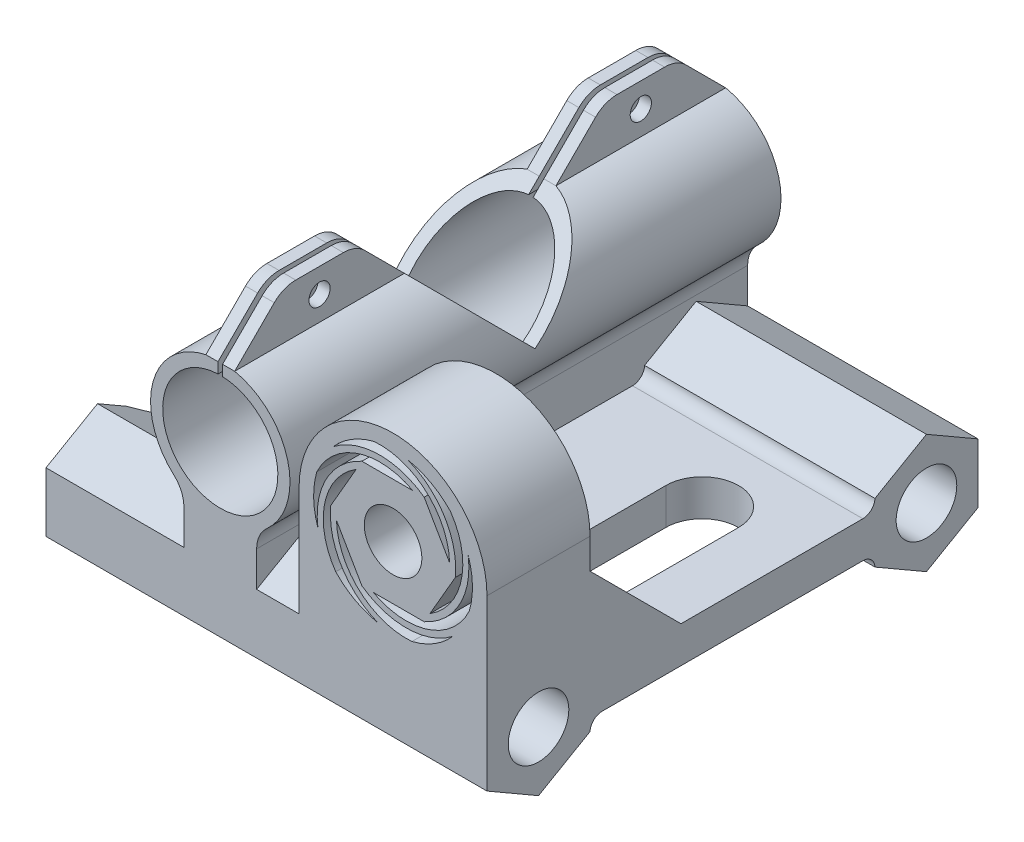
from build123d import *

# Parameters (mm, degrees)
BOSS_EXTRUDE1_DEPTH     = 72.75
CUT_EXTRUDE1_DEPTH      = 30
CUT_EXTRUDE1_DEPTH_BACK = 28
FILLET3_R               = 2
BOSS_EXTRUDE2_REACH     = 111.316
FILLET4_R               = 5
SKETCH5_R               = 4.75
BOSS_EXTRUDE7_DEPTH     = 17
CUT_EXTRUDE2_DEPTH      = 7.5
CUT_EXTRUDE3_REACH      = 109.48
SKETCH7_R               = 1.75
CHAMFER1_SIZE           = 8
FILLET5_R               = 5
SKETCH9_R               = 5
CUT_EXTRUDE5_DEPTH      = 50
CUT_EXTRUDE8_DEPTH      = 10
BOSS_EXTRUDE10_DEPTH    = 3.5
BOSS_EXTRUDE11_DEPTH    = 3.5
CUT_EXTRUDE9_DEPTH      = 17


# Some blends are built 0.0001 mm under size
with BuildPart() as part:
    # Sketch2 → Boss-Extrude1 (new body)
    with BuildSketch(Plane(origin=(0, 0, 0), x_dir=(0, 0, -1), z_dir=(1, 0, 0))):
        Polygon((2.888738281, 3), (49.888738281, 3), (49.888738281, 4.907477288), (58.388738281, 9.814954576), (66.888738281, 4.907477288), (66.888738281, -4.907477288), (58.388738281, -9.814954576), (49.888738281, -4.907477288), (49.888738281, -3), (2.888738281, -3), (2.888738281, -4.907477288), (-5.611261719, -9.814954576), (-14.111261719, -4.907477288), (-14.111261719, 4.907477288), (-5.611261719, 9.814954576), (2.888738281, 4.907477288), align=None)
    extrude(amount=BOSS_EXTRUDE1_DEPTH)

    # Sketch3 → Cut-Extrude1 (cut, two sides: drawn at the far end of the back side and taken through both)
    with BuildSketch(Plane(origin=(0, 3, 0), x_dir=(1, 0, 0), z_dir=(0, 1, 0)).offset(-CUT_EXTRUDE1_DEPTH_BACK)):
        Polygon((1.75, 48.138738281), (1.75, 2.888738281), (0, -0.861261719), (0, 51.638738281), (1.75, 49.888738281), align=None)
    extrude(amount=CUT_EXTRUDE1_DEPTH + CUT_EXTRUDE1_DEPTH_BACK, mode=Mode.SUBTRACT)

    # Fillet3
    # the kernel refuses this fillet: 2 mm, written as the material it adds along each edge
    with BuildSketch(Plane(origin=(1.75, -3, -2.888738281), x_dir=(0, 0, -1), z_dir=(1, 0, 0))) as fillet3_piece_1_section:
        with BuildLine():
            CenterArc((1.997858741, -2), FILLET3_R, 90, 87.348473215)
            Line((0, -1.907477288), (-0.039957175, -1.905626834))
            ThreePointArc((-0.039957175, -1.905626834), (-0.04, -0.953738644), (-0.04, 0))
            Line((-0.04, 0), (0, 0.04))
            Line((0, 0.04), (1.997858741, 0.04))
            Line((1.997858741, 0.04), (1.997858741, 0))
        make_face()
    fillet3_piece_1 = extrude(amount=71, mode=Mode.PRIVATE)
    fillet3_piece_1 = split(fillet3_piece_1, bisect_by=Plane(origin=(1.75, -3, -2.888738281), z_dir=(-0.9061831399952585, 0, -0.42288546533113874)), keep=Keep.TOP, mode=Mode.PRIVATE)
    add(fillet3_piece_1)
    with BuildSketch(Plane(origin=(-3.244646852, -3, -2.888738281), x_dir=(0, 0, -1), z_dir=(1, 0, 0))) as fillet3_piece_2_section:
        with BuildLine():
            CenterArc((1.997858741, -2), FILLET3_R, 90, 87.348473215)
            Line((0, -1.907477288), (-0.039957175, -1.905626834))
            ThreePointArc((-0.039957175, -1.905626834), (-0.04, -0.953738644), (-0.04, 0))
            Line((-0.04, 0), (0, 0.04))
            Line((0, 0.04), (1.997858741, 0.04))
            Line((1.997858741, 0.04), (1.997858741, 0))
        make_face()
    fillet3_piece_2 = extrude(amount=75.994646852, mode=Mode.PRIVATE)
    fillet3_piece_2 = split(fillet3_piece_2, bisect_by=Plane(origin=(1.75, -3, -2.888738281), z_dir=(-1, 0, 0)), keep=Keep.TOP, mode=Mode.PRIVATE)
    fillet3_piece_2 = split(fillet3_piece_2, bisect_by=Plane(origin=(0.856796731, -3, -0.974731276), z_dir=(0.9061831399952585, 0, 0.42288546533113874)), keep=Keep.TOP, mode=Mode.PRIVATE)
    add(fillet3_piece_2)
    with BuildSketch(Plane(origin=(1.75, -3, -2.888738281), x_dir=(0, 0, -1), z_dir=(1, 0, 0))) as fillet3_piece_3_section:
        with BuildLine():
            CenterArc((1.997858741, -2), FILLET3_R, 90, 87.348473215)
            Line((0, -1.907477288), (-0.039957175, -1.905626834))
            ThreePointArc((-0.039957175, -1.905626834), (-0.04, -0.953738644), (-0.04, 0))
            Line((-0.04, 0), (0, 0.04))
            Line((0, 0.04), (1.997858741, 0.04))
            Line((1.997858741, 0.04), (1.997858741, 0))
        make_face()
    fillet3_piece_3 = extrude(amount=71, mode=Mode.PRIVATE)
    fillet3_piece_3 = split(fillet3_piece_3, bisect_by=Plane(origin=(1.75, -3, -2.888738281), z_dir=(0.9061831399952585, 0, 0.42288546533113874)), keep=Keep.TOP, mode=Mode.PRIVATE)
    add(fillet3_piece_3)
    with BuildSketch(Plane(origin=(1.75, -3, -49.888738281), x_dir=(0, 0, 1), z_dir=(1, 0, 0))) as fillet3_piece_4_section:
        with BuildLine():
            CenterArc((1.997858741, 2), FILLET3_R, 182.651526785, 87.348473215)
            Line((0, 1.907477288), (-0.039957175, 1.905626834))
            ThreePointArc((-0.039957175, 1.905626834), (-0.04, 0.953738644), (-0.04, 0))
            Line((-0.04, 0), (0, -0.04))
            Line((0, -0.04), (1.997858741, -0.04))
            Line((1.997858741, -0.04), (1.997858741, 0))
        make_face()
    fillet3_piece_4 = extrude(amount=71, mode=Mode.PRIVATE)
    fillet3_piece_4 = split(fillet3_piece_4, bisect_by=Plane(origin=(1.75, -3, -49.888738281), z_dir=(-0.707106781186547, 0, 0.7071067811865481)), keep=Keep.TOP, mode=Mode.PRIVATE)
    add(fillet3_piece_4)
    with BuildSketch(Plane(origin=(-3.244646852, -3, -49.888738281), x_dir=(0, 0, 1), z_dir=(1, 0, 0))) as fillet3_piece_5_section:
        with BuildLine():
            CenterArc((1.997858741, 2), FILLET3_R, 182.651526785, 87.348473215)
            Line((0, 1.907477288), (-0.039957175, 1.905626834))
            ThreePointArc((-0.039957175, 1.905626834), (-0.04, 0.953738644), (-0.04, 0))
            Line((-0.04, 0), (0, -0.04))
            Line((0, -0.04), (1.997858741, -0.04))
            Line((1.997858741, -0.04), (1.997858741, 0))
        make_face()
    fillet3_piece_5 = extrude(amount=75.994646852, mode=Mode.PRIVATE)
    fillet3_piece_5 = split(fillet3_piece_5, bisect_by=Plane(origin=(1.75, -3, -49.888738281), z_dir=(-1, 0, 0)), keep=Keep.TOP, mode=Mode.PRIVATE)
    fillet3_piece_5 = split(fillet3_piece_5, bisect_by=Plane(origin=(-0.747323426, -3, -52.386061707), z_dir=(0.707106781186547, 0, -0.7071067811865481)), keep=Keep.TOP, mode=Mode.PRIVATE)
    add(fillet3_piece_5)
    with BuildSketch(Plane(origin=(1.75, -3, -49.888738281), x_dir=(0, 0, 1), z_dir=(1, 0, 0))) as fillet3_piece_6_section:
        with BuildLine():
            CenterArc((1.997858741, 2), FILLET3_R, 182.651526785, 87.348473215)
            Line((0, 1.907477288), (-0.039957175, 1.905626834))
            ThreePointArc((-0.039957175, 1.905626834), (-0.04, 0.953738644), (-0.04, 0))
            Line((-0.04, 0), (0, -0.04))
            Line((0, -0.04), (1.997858741, -0.04))
            Line((1.997858741, -0.04), (1.997858741, 0))
        make_face()
    fillet3_piece_6 = extrude(amount=71, mode=Mode.PRIVATE)
    fillet3_piece_6 = split(fillet3_piece_6, bisect_by=Plane(origin=(1.75, -3, -49.888738281), z_dir=(0.707106781186547, 0, -0.7071067811865481)), keep=Keep.TOP, mode=Mode.PRIVATE)
    add(fillet3_piece_6)
    with BuildSketch(Plane(origin=(1.75, 3, -49.888738281), x_dir=(0, 0, 1), z_dir=(1, 0, 0))) as fillet3_piece_7_section:
        with BuildLine():
            CenterArc((1.997858741, -2), FILLET3_R, 90, 87.348473215)
            Line((0, -1.907477288), (-0.039957175, -1.905626834))
            ThreePointArc((-0.039957175, -1.905626834), (-0.04, -0.953738644), (-0.04, 0))
            Line((-0.04, 0), (0, 0.04))
            Line((0, 0.04), (1.997858741, 0.04))
            Line((1.997858741, 0.04), (1.997858741, 0))
        make_face()
    fillet3_piece_7 = extrude(amount=71, mode=Mode.PRIVATE)
    fillet3_piece_7 = split(fillet3_piece_7, bisect_by=Plane(origin=(1.75, 3, -49.888738281), z_dir=(-0.707106781186547, 0, 0.7071067811865481)), keep=Keep.TOP, mode=Mode.PRIVATE)
    add(fillet3_piece_7)
    with BuildSketch(Plane(origin=(-3.244646852, 3, -49.888738281), x_dir=(0, 0, 1), z_dir=(1, 0, 0))) as fillet3_piece_8_section:
        with BuildLine():
            CenterArc((1.997858741, -2), FILLET3_R, 90, 87.348473215)
            Line((0, -1.907477288), (-0.039957175, -1.905626834))
            ThreePointArc((-0.039957175, -1.905626834), (-0.04, -0.953738644), (-0.04, 0))
            Line((-0.04, 0), (0, 0.04))
            Line((0, 0.04), (1.997858741, 0.04))
            Line((1.997858741, 0.04), (1.997858741, 0))
        make_face()
    fillet3_piece_8 = extrude(amount=75.994646852, mode=Mode.PRIVATE)
    fillet3_piece_8 = split(fillet3_piece_8, bisect_by=Plane(origin=(1.75, 3, -49.888738281), z_dir=(-1, 0, 0)), keep=Keep.TOP, mode=Mode.PRIVATE)
    fillet3_piece_8 = split(fillet3_piece_8, bisect_by=Plane(origin=(-0.747323426, 3, -52.386061707), z_dir=(0.707106781186547, 0, -0.7071067811865481)), keep=Keep.TOP, mode=Mode.PRIVATE)
    add(fillet3_piece_8)
    with BuildSketch(Plane(origin=(1.75, 3, -49.888738281), x_dir=(0, 0, 1), z_dir=(1, 0, 0))) as fillet3_piece_9_section:
        with BuildLine():
            CenterArc((1.997858741, -2), FILLET3_R, 90, 87.348473215)
            Line((0, -1.907477288), (-0.039957175, -1.905626834))
            ThreePointArc((-0.039957175, -1.905626834), (-0.04, -0.953738644), (-0.04, 0))
            Line((-0.04, 0), (0, 0.04))
            Line((0, 0.04), (1.997858741, 0.04))
            Line((1.997858741, 0.04), (1.997858741, 0))
        make_face()
    fillet3_piece_9 = extrude(amount=71, mode=Mode.PRIVATE)
    fillet3_piece_9 = split(fillet3_piece_9, bisect_by=Plane(origin=(1.75, 3, -49.888738281), z_dir=(0.707106781186547, 0, -0.7071067811865481)), keep=Keep.TOP, mode=Mode.PRIVATE)
    add(fillet3_piece_9)
    with BuildSketch(Plane(origin=(1.75, 3, -2.888738281), x_dir=(0, 0, -1), z_dir=(1, 0, 0))) as fillet3_piece_10_section:
        with BuildLine():
            CenterArc((1.997858741, 2), FILLET3_R, 182.651526785, 87.348473215)
            Line((0, 1.907477288), (-0.039957175, 1.905626834))
            ThreePointArc((-0.039957175, 1.905626834), (-0.04, 0.953738644), (-0.04, 0))
            Line((-0.04, 0), (0, -0.04))
            Line((0, -0.04), (1.997858741, -0.04))
            Line((1.997858741, -0.04), (1.997858741, 0))
        make_face()
    fillet3_piece_10 = extrude(amount=71, mode=Mode.PRIVATE)
    fillet3_piece_10 = split(fillet3_piece_10, bisect_by=Plane(origin=(1.75, 3, -2.888738281), z_dir=(-0.9061831399952585, 0, -0.42288546533113874)), keep=Keep.TOP, mode=Mode.PRIVATE)
    add(fillet3_piece_10)
    with BuildSketch(Plane(origin=(-3.244646852, 3, -2.888738281), x_dir=(0, 0, -1), z_dir=(1, 0, 0))) as fillet3_piece_11_section:
        with BuildLine():
            CenterArc((1.997858741, 2), FILLET3_R, 182.651526785, 87.348473215)
            Line((0, 1.907477288), (-0.039957175, 1.905626834))
            ThreePointArc((-0.039957175, 1.905626834), (-0.04, 0.953738644), (-0.04, 0))
            Line((-0.04, 0), (0, -0.04))
            Line((0, -0.04), (1.997858741, -0.04))
            Line((1.997858741, -0.04), (1.997858741, 0))
        make_face()
    fillet3_piece_11 = extrude(amount=75.994646852, mode=Mode.PRIVATE)
    fillet3_piece_11 = split(fillet3_piece_11, bisect_by=Plane(origin=(1.75, 3, -2.888738281), z_dir=(-1, 0, 0)), keep=Keep.TOP, mode=Mode.PRIVATE)
    fillet3_piece_11 = split(fillet3_piece_11, bisect_by=Plane(origin=(0.856796731, 3, -0.974731276), z_dir=(0.9061831399952585, 0, 0.42288546533113874)), keep=Keep.TOP, mode=Mode.PRIVATE)
    add(fillet3_piece_11)
    with BuildSketch(Plane(origin=(1.75, 3, -2.888738281), x_dir=(0, 0, -1), z_dir=(1, 0, 0))) as fillet3_piece_12_section:
        with BuildLine():
            CenterArc((1.997858741, 2), FILLET3_R, 182.651526785, 87.348473215)
            Line((0, 1.907477288), (-0.039957175, 1.905626834))
            ThreePointArc((-0.039957175, 1.905626834), (-0.04, 0.953738644), (-0.04, 0))
            Line((-0.04, 0), (0, -0.04))
            Line((0, -0.04), (1.997858741, -0.04))
            Line((1.997858741, -0.04), (1.997858741, 0))
        make_face()
    fillet3_piece_12 = extrude(amount=71, mode=Mode.PRIVATE)
    fillet3_piece_12 = split(fillet3_piece_12, bisect_by=Plane(origin=(1.75, 3, -2.888738281), z_dir=(0.9061831399952585, 0, 0.42288546533113874)), keep=Keep.TOP, mode=Mode.PRIVATE)
    add(fillet3_piece_12)

    # Boss-Extrude2: up to this face of the body (flat: up to its plane)
    boss_extrude2_end = Plane(part.part.faces().sort_by_distance((36.375, 0, 14.111261719))[0])
    # Sketch4 → Boss-Extrude2 (add, up to the picked face)
    with BuildSketch(Plane(origin=(0, 0, -66.888738281), x_dir=(-1, 0, 0), z_dir=(0, 0, -1)), mode=Mode.PRIVATE) as boss_extrude2_sk1:
        with BuildLine():
            Line((-34.75, 3), (-34.75, 13.189291565))
            ThreePointArc((-34.75, 13.189291565), (-40.08337785, 24.950524676), (-31.125, 34.25208314))
            Line((-31.125, 34.25208314), (-31.125, 42.25208314))
            Line((-31.125, 42.25208314), (-29.125, 42.25208314))
            Line((-29.125, 42.25208314), (-29.125, 32.492595799))
            ThreePointArc((-29.125, 32.492595799), (-28.75, 13.5), (-28.375, 32.492595799))
            Line((-28.375, 32.492595799), (-28.375, 42.25208314))
            Line((-28.375, 42.25208314), (-26.375, 42.25208314))
            Line((-26.375, 42.25208314), (-26.375, 34.25208314))
            ThreePointArc((-26.375, 34.25208314), (-17.41662215, 24.950524676), (-22.75, 13.189291565))
            Line((-22.75, 13.189291565), (-22.75, 3))
            Line((-22.75, 3), (-34.75, 3))
        make_face()
    boss_extrude2_tool1 = split(extrude(boss_extrude2_sk1.sketch, amount=-BOSS_EXTRUDE2_REACH, mode=Mode.PRIVATE), bisect_by=boss_extrude2_end, keep=Keep.BOTH, mode=Mode.PRIVATE)
    add(boss_extrude2_tool1.solids().sort_by(Axis((34.295058, 8.094646, -66.888738), (0, 0, 1)))[0])

    # Fillet4
    fillet4_edges = [part.edges().sort_by_distance(p)[0] for p in [
        (22.75, 13.189291565, -26.388738281),
        (34.75, 13.189291565, -26.388738281),
    ]]
    fillet(fillet4_edges, radius=FILLET4_R)

    # Sketch5 → Boss-Extrude7 (add)
    with BuildSketch(Plane(origin=(0, 0, 14.111261719), x_dir=(-1, 0, 0), z_dir=(0, 0, -1))):
        with BuildLine():
            Line((-72.75, 23), (-72.75, 4.907477288))
            Line((-72.75, 4.907477288), (-41.75, 4.907477288))
            Line((-41.75, 4.907477288), (-41.75, 23))
            ThreePointArc((-41.75, 23), (-57.25, 38.5), (-72.75, 23))
        make_face()
        with Locations((-57.25, 23)):
            Circle(SKETCH5_R, mode=Mode.SUBTRACT)
    extrude(amount=BOSS_EXTRUDE7_DEPTH)

    # Sketch6 → Cut-Extrude2 (cut)
    with BuildSketch(Plane(origin=(0, 0, -2.888738281), x_dir=(-1, 0, 0), z_dir=(0, 0, -1))):
        Polygon((-49.744446501, 23), (-53.49722325, 29.5), (-61.00277675, 29.5), (-64.755553499, 23), (-61.00277675, 16.5), (-53.49722325, 16.5), align=None)
    extrude(amount=-CUT_EXTRUDE2_DEPTH, mode=Mode.SUBTRACT)

    # Cut-Extrude3: up to this face of the body (flat: up to its plane)
    cut_extrude3_end = Plane(part.part.faces().sort_by_distance((41.75, 15.11644235, 5.611261719))[0])
    # Sketch7 → Cut-Extrude3 (cut, up to the picked face)
    with BuildSketch(Plane.ZY, mode=Mode.PRIVATE) as cut_extrude3_sk1:
        with Locations((0.111261719, 38.25208314)):
            Circle(SKETCH7_R)
    cut_extrude3_tool1 = split(extrude(cut_extrude3_sk1.sketch, amount=-CUT_EXTRUDE3_REACH, mode=Mode.PRIVATE), bisect_by=cut_extrude3_end, keep=Keep.BOTH, mode=Mode.PRIVATE)
    # Sketch7 → Cut-Extrude3 (cut, up to the picked face)
    with BuildSketch(Plane.ZY, mode=Mode.PRIVATE) as cut_extrude3_sk2:
        with Locations((-52.888738281, 38.25208314)):
            Circle(SKETCH7_R)
    cut_extrude3_tool2 = split(extrude(cut_extrude3_sk2.sketch, amount=-CUT_EXTRUDE3_REACH, mode=Mode.PRIVATE), bisect_by=cut_extrude3_end, keep=Keep.BOTH, mode=Mode.PRIVATE)
    # Sketch7 → Cut-Extrude3 (cut, up to the picked face)
    with BuildSketch(Plane.ZY, mode=Mode.PRIVATE) as cut_extrude3_sk3:
        Polygon((-38.888738281, 34.25208314), (-26.388738281, 21.75208314), (-13.888738281, 34.25208314), (-13.888738281, 42.25208314), (-38.888738281, 42.25208314), align=None)
    cut_extrude3_tool3 = split(extrude(cut_extrude3_sk3.sketch, amount=-CUT_EXTRUDE3_REACH, mode=Mode.PRIVATE), bisect_by=cut_extrude3_end, keep=Keep.BOTH, mode=Mode.PRIVATE)
    add(cut_extrude3_tool1.solids().sort_by(Axis((0, 38.252083, 0.111262), (1, 0, 0)))[0], mode=Mode.SUBTRACT)
    add(cut_extrude3_tool2.solids().sort_by(Axis((0, 38.252083, -52.888738), (1, 0, 0)))[0], mode=Mode.SUBTRACT)
    add(cut_extrude3_tool3.solids().sort_by(Axis((0, 34.670212, -26.388738), (1, 0, 0)))[0], mode=Mode.SUBTRACT)

    # Chamfer1
    chamfer1_edges = [part.edges().sort_by_distance(p)[0] for p in [
        (27.375, 42.25208314, -38.888738281),
        (27.375, 42.25208314, -66.888738281),
        (27.375, 42.25208314, -13.888738281),
        (27.375, 42.25208314, 14.111261719),
        (30.125, 42.25208314, -38.888738281),
        (30.125, 42.25208314, -66.888738281),
        (30.125, 42.25208314, -13.888738281),
        (30.125, 42.25208314, 14.111261719),
    ]]
    chamfer(chamfer1_edges, length=CHAMFER1_SIZE - 0.0001)  # a hair under: the kernel refuses the full size

    # Fillet5
    fillet5_edges = [part.edges().sort_by_distance(p)[0] for p in [
        (27.375, 42.25208314, -46.888638281),
        (27.375, 42.25208314, -58.888838281),
        (30.125, 42.25208314, -46.888638281),
        (30.125, 42.25208314, -58.888838281),
        (30.125, 42.25208314, -5.888838281),
        (30.125, 42.25208314, 6.111361719),
        (27.375, 42.25208314, -5.888838281),
        (27.375, 42.25208314, 6.111361719),
    ]]
    fillet(fillet5_edges, radius=FILLET5_R)

    # Sketch9 → Cut-Extrude5 (cut)
    with BuildSketch(Plane(origin=(72.75, 0, 0), x_dir=(0, 0, -1), z_dir=(1, 0, 0))):
        with Locations((58.388738281, 0)):
            Circle(SKETCH9_R)
        with Locations((-5.611261719, 0)):
            Circle(SKETCH9_R)
    extrude(amount=-CUT_EXTRUDE5_DEPTH, mode=Mode.SUBTRACT)

    # Sketch14 → Cut-Extrude8 (cut)
    with BuildSketch(Plane(origin=(0, 3, 0), x_dir=(1, 0, 0), z_dir=(0, 1, 0))):
        with BuildLine():
            Line((63.75, 36.388738281), (63.75, 14.388738281))
            ThreePointArc((63.75, 14.388738281), (57.75, 8.388738281), (51.75, 14.388738281))
            Line((51.75, 14.388738281), (51.75, 36.388738281))
            ThreePointArc((51.75, 36.388738281), (57.75, 42.388738281), (63.75, 36.388738281))
        make_face()
    extrude(amount=-CUT_EXTRUDE8_DEPTH, mode=Mode.SUBTRACT)

    # Sketch18 → Boss-Extrude10 (add)
    with BuildSketch(Plane(origin=(72.75, 0, 0), x_dir=(0, 0, -1), z_dir=(1, 0, 0))):
        Polygon((2.8941426, 18), (2.8941426, 3), (17.8941426, 3), align=None)
    extrude(amount=-BOSS_EXTRUDE10_DEPTH)

    # Sketch19 → Boss-Extrude11 (add)
    with BuildSketch(Plane.ZY.offset(-41.75)):
        Polygon((-2.8941426, 18), (-17.8941426, 3), (-2.888738281, 3), align=None)
    extrude(amount=-BOSS_EXTRUDE11_DEPTH)

    # Sketch20 → Cut-Extrude9 (cut)
    with BuildSketch(Plane(origin=(0, 0, -2.888738281), x_dir=(-1, 0, 0), z_dir=(0, 0, -1))):
        with BuildLine():
            Line((-51.169668777, 30.268557394), (-46.973165208, 23))
            ThreePointArc((-46.973165208, 23), (-48.708167863, 15.27633314), (-54.734893722, 10.143708139))
            ThreePointArc((-54.734893722, 10.143708139), (-50.970310295, 11.503239708), (-47.791958625, 13.936035451))
            ThreePointArc((-47.791958625, 13.936035451), (-45.973983373, 22.827539985), (-51.169668777, 30.268557394))
        make_face()
        with BuildLine():
            Line((-47.915079036, 21.368557394), (-52.111582604, 14.1))
            ThreePointArc((-52.111582604, 14.1), (-59.667975643, 11.740722944), (-67.126322211, 14.393708139))
            ThreePointArc((-67.126322211, 14.393708139), (-64.066641622, 11.813249042), (-60.370602871, 10.277113625))
            ThreePointArc((-60.370602871, 10.277113625), (-51.761346441, 13.14845314), (-47.915079036, 21.368557394))
        make_face()
        with BuildLine():
            Line((-53.99541026, 14.1), (-62.388417396, 14.1))
            ThreePointArc((-62.388417396, 14.1), (-68.20980778, 19.464389804), (-69.641428489, 27.25))
            ThreePointArc((-69.641428489, 27.25), (-70.346331326, 23.310009334), (-69.828644246, 19.341078174))
            ThreePointArc((-69.828644246, 19.341078174), (-63.037363068, 13.320913155), (-53.99541026, 14.1))
        make_face()
        with BuildLine():
            Line((-63.330331223, 15.731442606), (-67.526834792, 23))
            ThreePointArc((-67.526834792, 23), (-65.791832137, 30.72366686), (-59.765106278, 35.856291861))
            ThreePointArc((-59.765106278, 35.856291861), (-63.529689705, 34.496760292), (-66.708041375, 32.063964549))
            ThreePointArc((-66.708041375, 32.063964549), (-68.526016627, 23.172460015), (-63.330331223, 15.731442606))
        make_face()
        with BuildLine():
            Line((-66.584920964, 24.631442606), (-62.388417396, 31.9))
            ThreePointArc((-62.388417396, 31.9), (-54.832024357, 34.259277056), (-47.373677789, 31.606291861))
            ThreePointArc((-47.373677789, 31.606291861), (-50.433358378, 34.186750958), (-54.129397129, 35.722886375))
            ThreePointArc((-54.129397129, 35.722886375), (-62.738653559, 32.85154686), (-66.584920964, 24.631442606))
        make_face()
        with BuildLine():
            Line((-60.50458974, 31.9), (-52.111582604, 31.9))
            ThreePointArc((-52.111582604, 31.9), (-46.29019222, 26.535610196), (-44.858571511, 18.75))
            ThreePointArc((-44.858571511, 18.75), (-44.153668674, 22.689990666), (-44.671355754, 26.658921826))
            ThreePointArc((-44.671355754, 26.658921826), (-51.462636932, 32.679086845), (-60.50458974, 31.9))
        make_face()
    extrude(amount=-CUT_EXTRUDE9_DEPTH, mode=Mode.SUBTRACT)


solid = part.part
